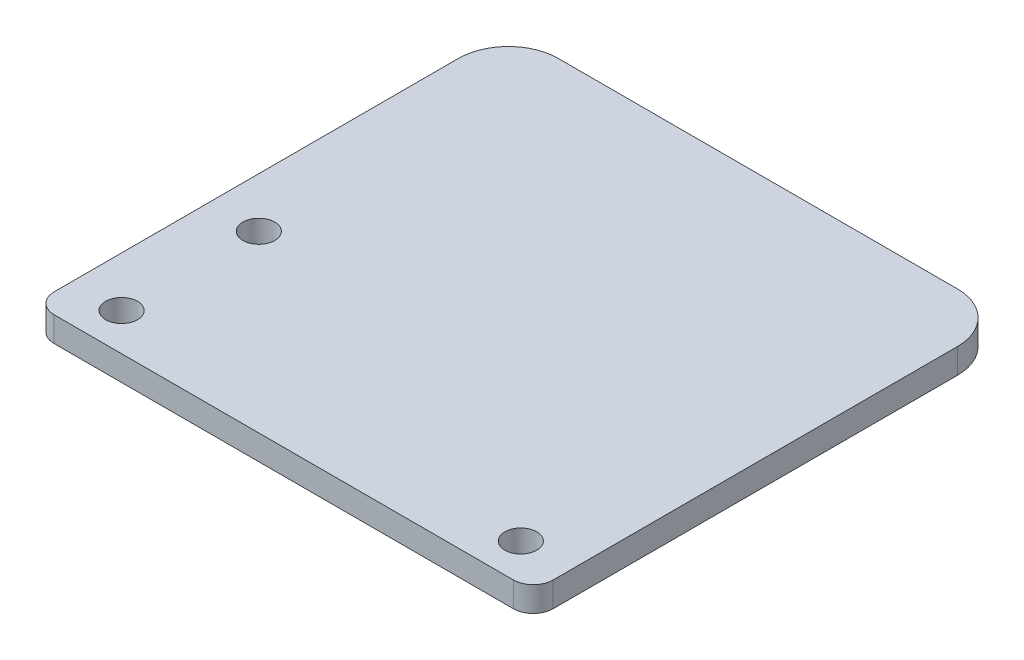
from build123d import *

# Parameters (mm, degrees)
SKETCH1_W           = 63.5
SKETCH1_H           = 60.325
BOSS_EXTRUDE1_DEPTH = 3.175
SKETCH2_R           = 2.032
CUT_EXTRUDE1_DEPTH  = 44.908080478
FILLET1_R           = 2.54
FILLET2_R           = 6.35
SKETCH3_R           = 2.032
CUT_EXTRUDE2_DEPTH  = 44.908080478


with BuildPart() as part:
    # Sketch1 → Boss-Extrude1 (new body)
    with BuildSketch(Plane(origin=(0, 0, 0), x_dir=(1, 0, 0), z_dir=(0, 1, 0))):
        Rectangle(SKETCH1_W, SKETCH1_H)
    extrude(amount=BOSS_EXTRUDE1_DEPTH)

    # Sketch2 → Cut-Extrude1 (cut, through all)
    with BuildSketch(Plane(origin=(0, 0, 0), x_dir=(-1, 0, 0), z_dir=(0, -1, 0))):
        with Locations((-25.4, -25.4)):
            Circle(SKETCH2_R)
        with Locations((25.4, -25.4)):
            Circle(SKETCH2_R)
    extrude(amount=-CUT_EXTRUDE1_DEPTH, mode=Mode.SUBTRACT)

    # Fillet1
    fillet1_edges = [part.edges().sort_by_distance(p)[0] for p in [
        (-31.75, 1.5875, 30.1625),
        (31.75, 1.5875, 30.1625),
    ]]
    fillet(fillet1_edges, radius=FILLET1_R)

    # Fillet2
    fillet2_edges = [part.edges().sort_by_distance(p)[0] for p in [
        (31.75, 1.5875, -30.1625),
        (-31.75, 1.5875, -30.1625),
    ]]
    fillet(fillet2_edges, radius=FILLET2_R)

    # Sketch3 → Cut-Extrude2 (cut, through all)
    with BuildSketch(Plane(origin=(0, 0, 0), x_dir=(-1, 0, 0), z_dir=(0, -1, 0))):
        with Locations((25.4, -7.9375)):
            Circle(SKETCH3_R)
    extrude(amount=-CUT_EXTRUDE2_DEPTH, mode=Mode.SUBTRACT)


solid = part.part
